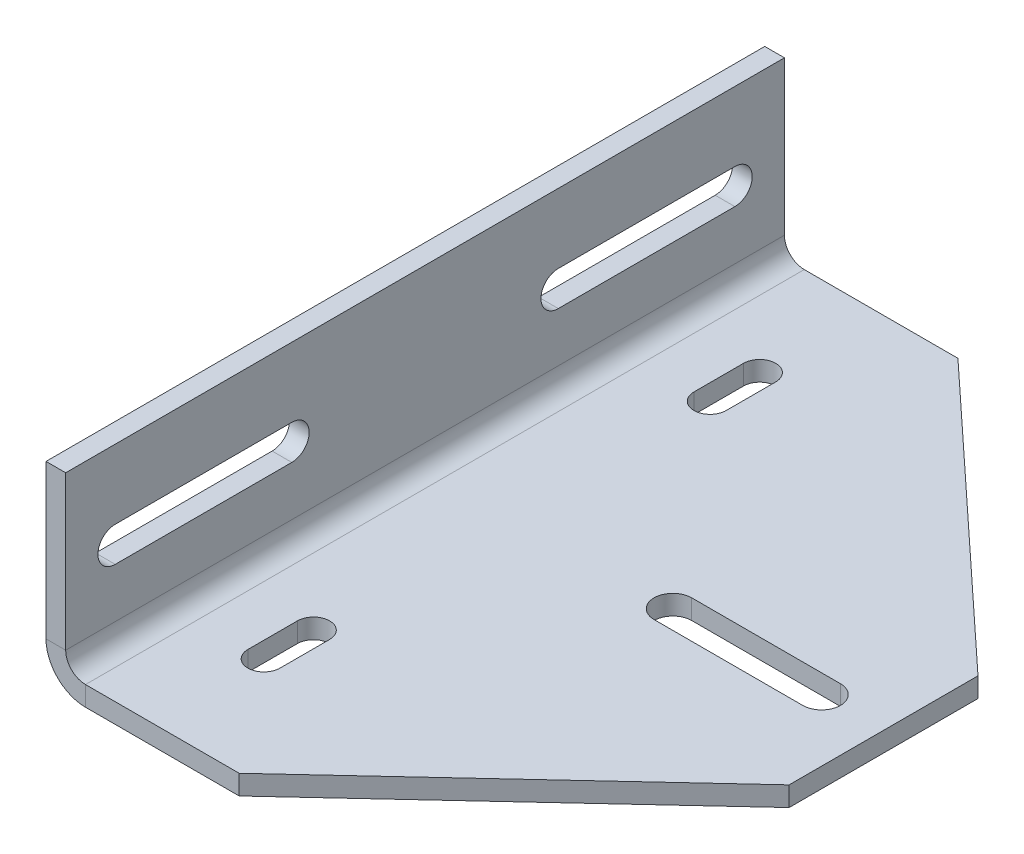
from build123d import *

# Parameters (mm, degrees)
SALIENTE_EXTRUIR1_DEPTH   = 7.9375
CROQUIS2_W                = 290
CROQUIS2_H                = 77.9375
SALIENTE_EXTRUIR2_DEPTH   = 7.9375
CONVERTIR_S_LIDO1_START   = -145
CONVERTIR_S_LIDO1_DEPTH   = 290
CONVERTIR_S_LIDO1_2_DEPTH = 290


# Read off the part's stored shape, not the designer's step: Convertir-Sólido1
with BuildPart() as part:
    # Croquis1 → Saliente-Extruir1 (new body)
    with BuildSketch(Plane(origin=(0, 0, 0), x_dir=(1, 0, 0), z_dir=(0, 1, 0))):
        Polygon((70, -145), (0, -145), (0, 145), (70, 145), (185, 38.1), (185, -38.1), align=None)
        with BuildLine():
            ThreePointArc((41.5, -80), (35, -73.5), (28.5, -80))
            Line((28.5, -80), (28.5, -100))
            ThreePointArc((28.5, -100), (35, -106.5), (41.5, -100))
            Line((41.5, -100), (41.5, -80))
        make_face(mode=Mode.SUBTRACT)
        with BuildLine():
            ThreePointArc((160, -7.597922996), (167.597922996, 0), (160, 7.597922996))
            Line((160, 7.597922996), (100, 7.597922996))
            ThreePointArc((100, 7.597922996), (92.402077004, 0), (100, -7.597922996))
            Line((100, -7.597922996), (160, -7.597922996))
        make_face(mode=Mode.SUBTRACT)
        with BuildLine():
            Line((41.5, 100), (41.5, 80))
            ThreePointArc((41.5, 80), (35, 73.5), (28.5, 80))
            Line((28.5, 80), (28.5, 100))
            ThreePointArc((28.5, 100), (35, 106.5), (41.5, 100))
        make_face(mode=Mode.SUBTRACT)
    extrude(amount=SALIENTE_EXTRUIR1_DEPTH)

    # Croquis2 → Saliente-Extruir2 (add)
    with BuildSketch(Plane.ZY):
        with Locations((0, 38.96875)):
            Rectangle(CROQUIS2_W, CROQUIS2_H)
        with BuildLine():
            ThreePointArc((-125, 35.9375), (-132, 42.9375), (-125, 49.9375))
            Line((-125, 49.9375), (-53.76065494, 49.9375))
            ThreePointArc((-53.76065494, 49.9375), (-46.76065494, 42.9375), (-53.76065494, 35.9375))
            Line((-53.76065494, 35.9375), (-125, 35.9375))
        make_face(mode=Mode.SUBTRACT)
        with BuildLine():
            Line((53.76065494, 49.9375), (125, 49.9375))
            ThreePointArc((125, 49.9375), (132, 42.9375), (125, 35.9375))
            Line((125, 35.9375), (53.76065494, 35.9375))
            ThreePointArc((53.76065494, 35.9375), (46.76065494, 42.9375), (53.76065494, 49.9375))
        make_face(mode=Mode.SUBTRACT)
    extrude(amount=SALIENTE_EXTRUIR2_DEPTH)

    # Convertir-Sólido1 outline → Convertir-Sólido1 (cut)
    with BuildSketch(Plane.XY.offset(CONVERTIR_S_LIDO1_START)):
        with BuildLine():
            Line((-7.9375, 0), (8, 0))
            ThreePointArc((8, 0), (-3.269514325, 4.667985675), (-7.9375, 15.9375))
            Line((-7.9375, 15.9375), (-7.9375, 0))
        make_face()
    extrude(amount=CONVERTIR_S_LIDO1_DEPTH, mode=Mode.SUBTRACT)

    # Convertir-S_lido1 2 outline → Convertir-S_lido1 2 (add)
    with BuildSketch(Plane.XY.offset(CONVERTIR_S_LIDO1_START)):
        with BuildLine():
            Line((0, 7.9375), (8, 7.9375))
            ThreePointArc((8, 7.9375), (2.343145751, 10.280645751), (0, 15.9375))
            Line((0, 15.9375), (0, 7.9375))
        make_face()
    extrude(amount=CONVERTIR_S_LIDO1_2_DEPTH)


solid = part.part
